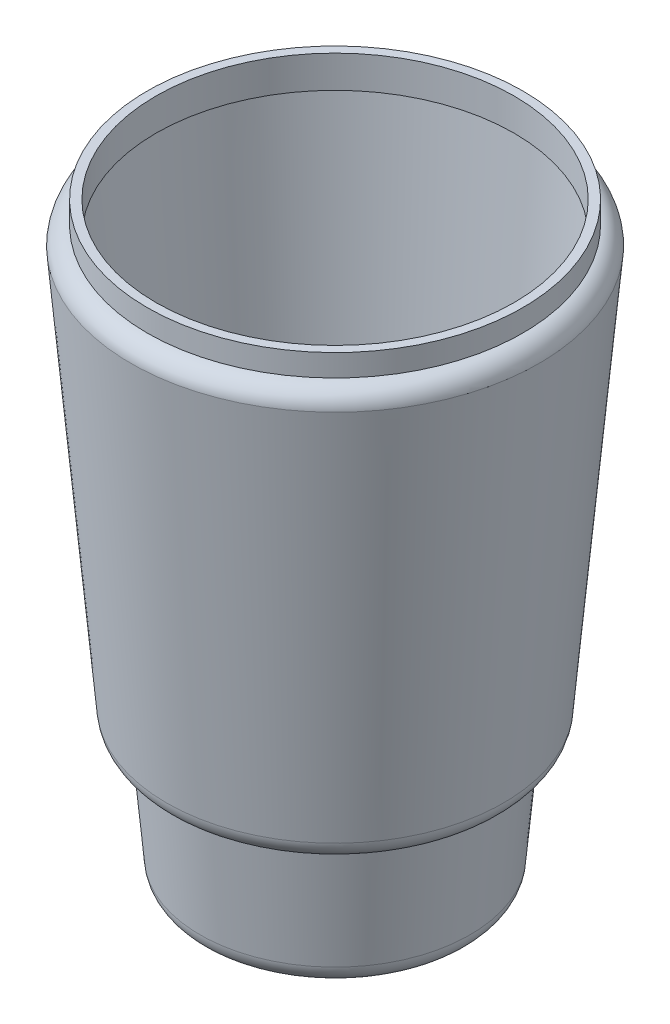
from build123d import *


# Read off the part's stored shape, not the designer's step: Shell1
with BuildPart() as part:
    # Sketch1 → Revolve1 (revolve)
    with BuildSketch(Plane(origin=(0, 0, 0), x_dir=(0, 0, -1), z_dir=(1, 0, 0))):
        with BuildLine():
            Line((0, 0), (25.926538287, 0))
            ThreePointArc((25.926538287, 0), (29.301201348, 1.310603135), (30.906726813, 4.55534031))
            Line((30.906726813, 4.55534031), (33.178571429, 30))
            Line((33.178571429, 30), (33.605109715, 30))
            ThreePointArc((33.605109715, 30), (36.979772776, 31.310603135), (38.585298242, 34.55534031))
            Line((38.585298242, 34.55534031), (46.732607482, 125.805203793))
            ThreePointArc((46.732607482, 125.805203793), (45.602025622, 128.540844981), (43, 129.952018505))
            Line((43, 129.952018505), (43, 135))
            Line((43, 135), (0, 135))
            Line((0, 135), (0, 0))
        make_face()
    revolve(axis=Axis((0, 0, 0), (0, 1, 0)))

    # Shell1 outline → Shell1 (revolve, cut)
    with BuildSketch(Plane.XY):
        with BuildLine():
            Line((41, 127.619980078), (41, 135))
            Line((41, 135), (0, 135))
            Line((0, 135), (0, 2))
            Line((0, 2), (25.926538287, 2))
            ThreePointArc((25.926538287, 2), (27.951336123, 2.786361881), (28.914651403, 4.733204186))
            Line((28.914651403, 4.733204186), (31.349186743, 32))
            Line((31.349186743, 32), (33.605109715, 32))
            ThreePointArc((33.605109715, 32), (35.629907552, 32.786361881), (36.593222831, 34.733204186))
            Line((36.593222831, 34.733204186), (44.726191, 125.822447676))
            ThreePointArc((44.726191, 125.822447676), (43.366524853, 127.764796691), (41, 127.619980078))
        make_face()
    revolve(axis=Axis((0, 0, 0), (0, 1, 0)), mode=Mode.SUBTRACT)


solid = part.part
